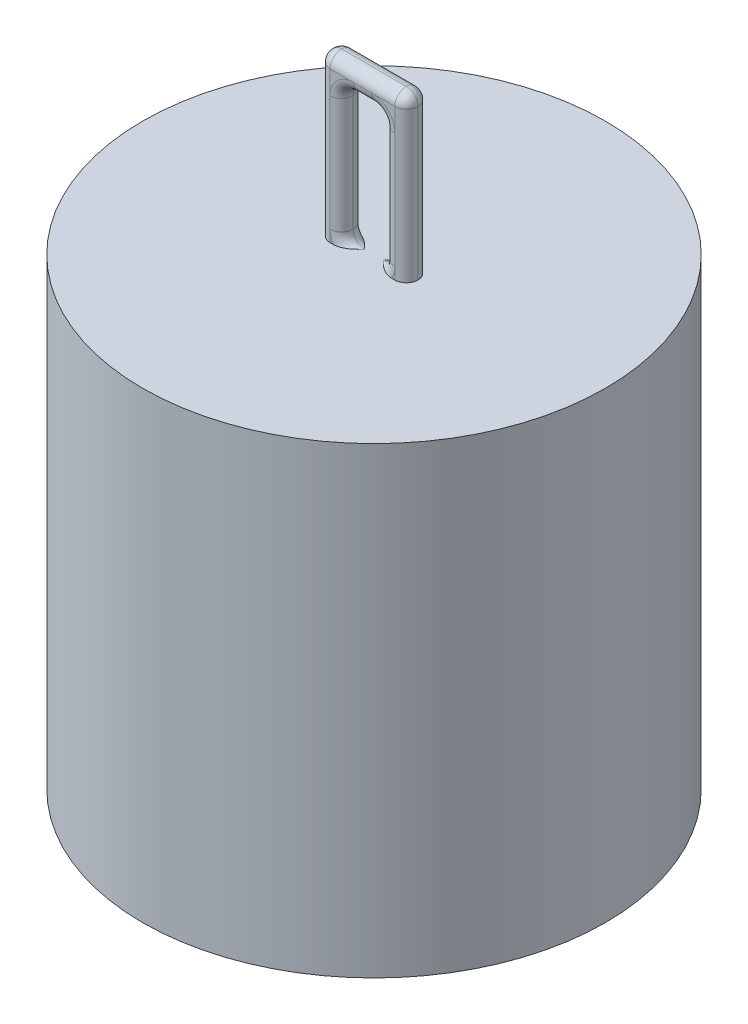
from build123d import *

# Parameters (mm, degrees)
SKETCH1_W           = 190
SKETCH1_H           = 400
SKETCH1_W_2         = 90
SKETCH1_H_2         = 300
BOSS_EXTRUDE1_DEPTH = 25
FILLET1_R           = 25
SKETCH2_R           = 500
BOSS_EXTRUDE2_DEPTH = 1000


with BuildPart() as part:
    # Sketch1 → Boss-Extrude1 (new, symmetric)
    with BuildSketch(Plane.XY):
        with Locations((0, -175)):
            Rectangle(SKETCH1_W, SKETCH1_H)
        with Locations((0, -175)):
            Rectangle(SKETCH1_W_2, SKETCH1_H_2, mode=Mode.SUBTRACT)
    extrude(amount=BOSS_EXTRUDE1_DEPTH, both=True)

    # Fillet1
    fillet1_edges = [part.edges().sort_by_distance(p)[0] for p in [
        (95, -175, 25),
        (0, 25, 25),
        (-45, -175, -25),
        (-45, -25, 0),
        (0, -325, -25),
        (-45, -325, 0),
        (45, -175, -25),
        (45, -325, 0),
        (0, -25, -25),
        (45, -25, 0),
        (-45, -175, 25),
        (0, -325, 25),
        (45, -175, 25),
        (0, -25, 25),
        (-95, -175, 25),
        (0, 25, -25),
        (95, -175, -25),
        (0, -375, -25),
        (-95, -175, -25),
        (0, -375, 25),
        (-95, 25, 0),
        (95, 25, 0),
        (95, -375, 0),
        (-95, -375, 0),
    ]]
    fillet(fillet1_edges, radius=FILLET1_R - 0.0001)  # a hair under: the kernel refuses the full size

    # Sketch2 → Boss-Extrude2 (add)
    with BuildSketch(Plane(origin=(0, -325, 0), x_dir=(1, 0, 0), z_dir=(0, 1, 0))):
        with Locations(Location((0, 0, 0), (0, 0, 270))):
            Circle(SKETCH2_R)
    extrude(amount=-BOSS_EXTRUDE2_DEPTH)


solid = part.part
